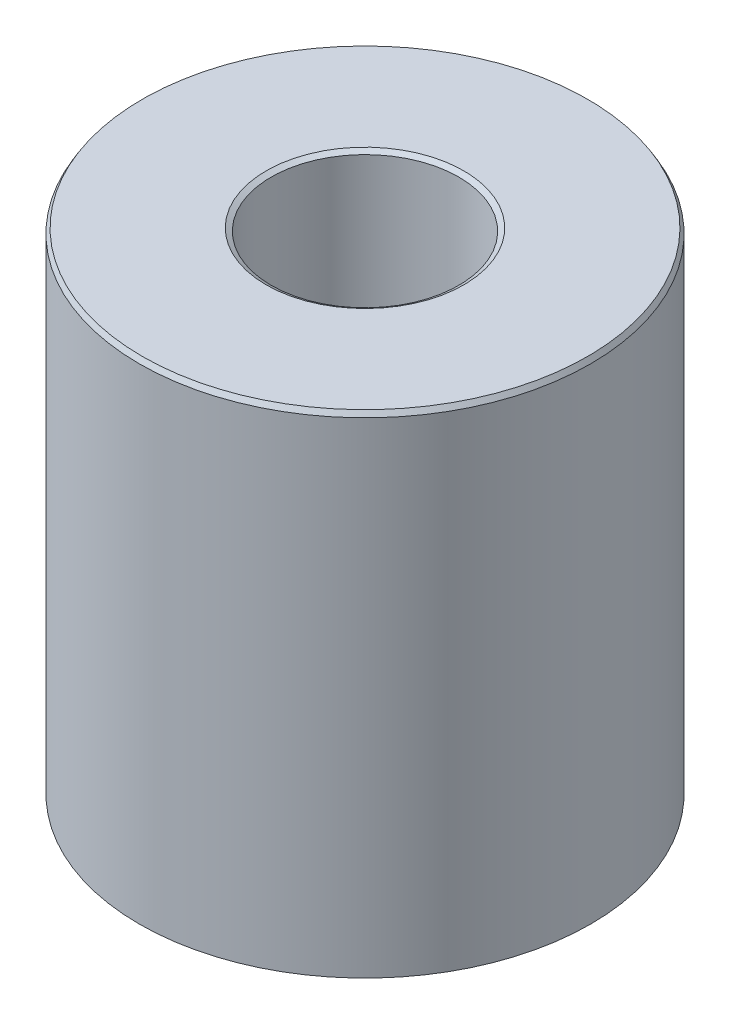
from build123d import *
from OCP.BRepFilletAPI import BRepFilletAPI_MakeChamfer

# Parameters (mm, degrees)
SKETCH1_R           = 27.5
BOSS_EXTRUDE1_DEPTH = 60.10702348
SKETCH2_R           = 11.437106748
CUT_EXTRUDE1_DEPTH  = 72.591579614
CHAMFER1_SIZE       = 0.608586
CHAMFER1_SIZE2      = 0.352995868


with BuildPart() as part:
    # Sketch1 → Boss-Extrude1 (new body)
    with BuildSketch(Plane(origin=(0, 0, 0), x_dir=(1, 0, 0), z_dir=(0, 1, 0))):
        Circle(SKETCH1_R)
    extrude(amount=BOSS_EXTRUDE1_DEPTH)

    # Sketch2 → Cut-Extrude1 (cut, through all)
    with BuildSketch(Plane(origin=(0, 0, 0), x_dir=(1, 0, 0), z_dir=(0, 1, 0))):
        Circle(SKETCH2_R)
    extrude(amount=CUT_EXTRUDE1_DEPTH, mode=Mode.SUBTRACT)

    # Chamfer1: one chamfer whose edges measure the first distance from different faces: ONE call of the kernel's chamfer builder (chamfer() names one face for all edges)
    chamfer1_edges_1 = [part.edges().sort_by_distance(p)[0] for p in [
        (-11.437106748, 60.10702348, 0),
    ]]
    chamfer1_side_1 = [part.faces().sort_by_distance(p)[0] for p in [
        (-26.722182541, 60.10702348, 0),
    ]]
    chamfer1_edges_2 = [part.edges().sort_by_distance(p)[0] for p in [
        (-11.437106748, 0, 0),
    ]]
    chamfer1_side_2 = [part.faces().sort_by_distance(p)[0] for p in [
        (-11.437106748, 30.05351174, 0),
    ]]
    chamfer1_edges_3 = [part.edges().sort_by_distance(p)[0] for p in [
        (-27.5, 0, 0),
    ]]
    chamfer1_side_3 = [part.faces().sort_by_distance(p)[0] for p in [
        (-26.722182541, 0, 0),
    ]]
    chamfer1_edges_4 = [part.edges().sort_by_distance(p)[0] for p in [
        (-27.5, 60.10702348, 0),
    ]]
    chamfer1_side_4 = [part.faces().sort_by_distance(p)[0] for p in [
        (-27.5, 30.05351174, 0),
    ]]
    chamfer1 = BRepFilletAPI_MakeChamfer(part.part.solid().wrapped)
    for e in chamfer1_edges_1:
        chamfer1.Add(CHAMFER1_SIZE, CHAMFER1_SIZE2, e.wrapped, chamfer1_side_1[0].wrapped)  # the first distance lies on this face
    for e in chamfer1_edges_2:
        chamfer1.Add(CHAMFER1_SIZE, CHAMFER1_SIZE2, e.wrapped, chamfer1_side_2[0].wrapped)  # the first distance lies on this face
    for e in chamfer1_edges_3:
        chamfer1.Add(CHAMFER1_SIZE, CHAMFER1_SIZE2, e.wrapped, chamfer1_side_3[0].wrapped)  # the first distance lies on this face
    for e in chamfer1_edges_4:
        chamfer1.Add(CHAMFER1_SIZE, CHAMFER1_SIZE2, e.wrapped, chamfer1_side_4[0].wrapped)  # the first distance lies on this face
    add(Compound.cast(chamfer1.Shape()), mode=Mode.REPLACE)


solid = part.part
